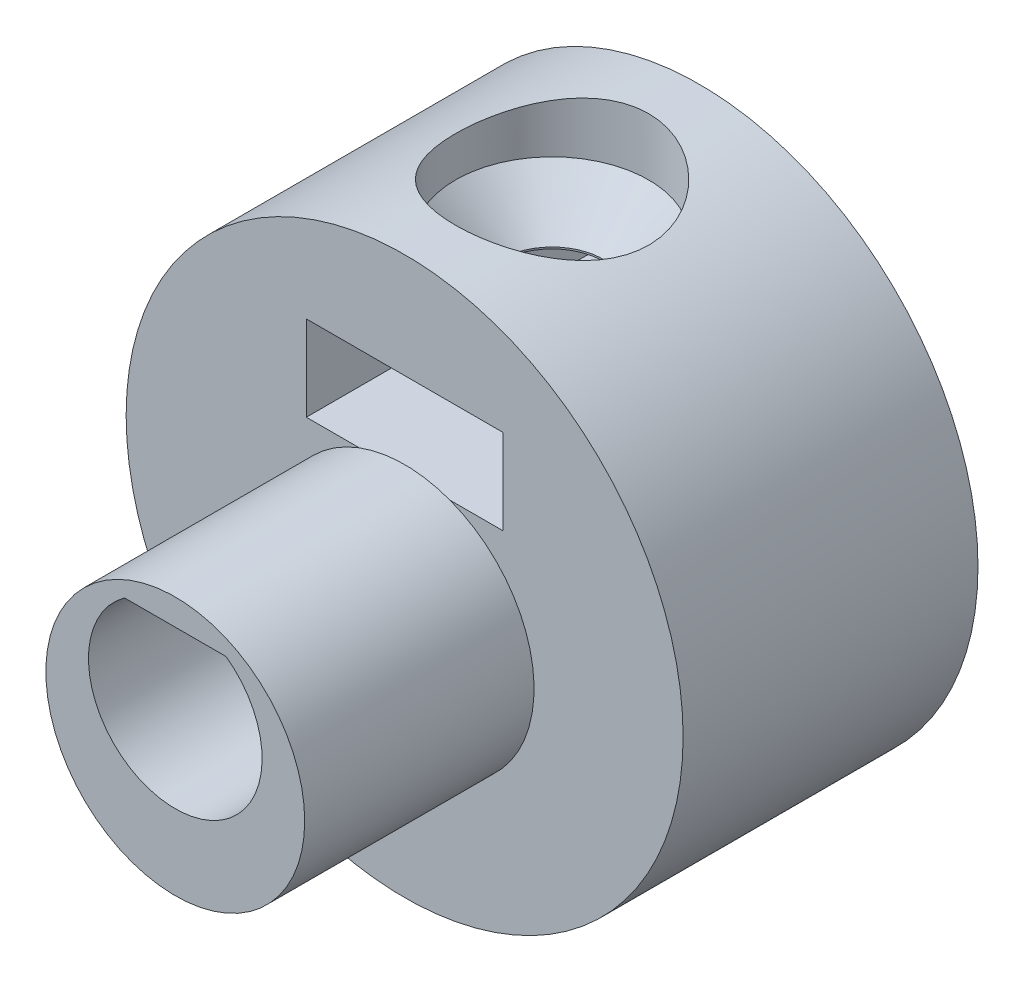
from build123d import *

# Parameters (mm, degrees)
ESQUISSE1_R             = 8.5
BOSS_EXTRU_1_DEPTH      = 9
ESQUISSE2_W             = 6
ESQUISSE2_H             = 2.6
ENL_V_MAT_EXTRU_1_DEPTH = 16.016657418
ESQUISSE7_R             = 2.95
ENL_V_MAT_EXTRU_8_DEPTH = 21.868397324
ESQUISSE9_R             = 3.95
BOSS_EXTRU_2_DEPTH      = 7
ENL_V_MAT_EXTRU_9_DEPTH = 21.012496182


with BuildPart() as part:
    # Esquisse1 → Boss.-Extru.1 (new body)
    with BuildSketch(Plane.XY):
        Circle(ESQUISSE1_R)
    extrude(amount=BOSS_EXTRU_1_DEPTH)

    # Esquisse2 → Enlèv. mat.-Extru.1 (cut, through all)
    with BuildSketch(Plane(origin=(0, 0, 0), x_dir=(-1, 0, 0), z_dir=(0, 0, -1))):
        with Locations((0, 4)):
            Rectangle(ESQUISSE2_W, ESQUISSE2_H)
    extrude(amount=-ENL_V_MAT_EXTRU_1_DEPTH, mode=Mode.SUBTRACT)

    # Enlèv. mat.-Extru.2: read off the stored shape, not the designer's step
    # Enlèv. mat.-Extru.2 outline → Enlèv. mat.-Extru.2 (revolve, cut)
    with BuildSketch(Plane.XY.offset(4.5)):
        Polygon((0, 5.3), (1.554616831, 5.3), (1.498760014, 8.500034923), (0, 8.500034923), align=None)
        Polygon((1.6, 2.7), (0, 2.7), (0, 0.7), (1.56508987, 0.7), align=None)
    revolve(axis=Axis((0, 0, 4.5), (0, 1, 0)), mode=Mode.SUBTRACT)

    # Esquisse7 → Enlèv. mat.-Extru.8 (cut, through all)
    with BuildSketch(Plane(origin=(0, 8.3, 0), x_dir=(1, 0, 0), z_dir=(0, 1, 0))):
        with Locations((0, -4.5)):
            Circle(ESQUISSE7_R)
    extrude(amount=ENL_V_MAT_EXTRU_8_DEPTH, mode=Mode.SUBTRACT)

    # Chanfrein1: read off the stored shape, not the designer's step
    # Chanfrein1 outline → Chanfrein1 (revolve, cut)
    with BuildSketch(Plane.XY.offset(4.5)):
        Polygon((2.95, 6.747748364), (2.95, 8.3), (1.502251636, 8.3), (1.553718474, 5.351466838), align=None)
    revolve(axis=Axis((0, 0, 4.5), (0, 1, 0)), mode=Mode.SUBTRACT)

    # Esquisse9 → Boss.-Extru.2 (add)
    with BuildSketch(Plane.XY.offset(9)):
        with Locations(Location((0, -1, 0), (0, 0, 110.493999506))):
            Circle(ESQUISSE9_R)
    extrude(amount=BOSS_EXTRU_2_DEPTH)

    # Esquisse10 → Enlèv. mat.-Extru.9 (cut, through all)
    with BuildSketch(Plane(origin=(0, 0, 0), x_dir=(-1, 0, 0), z_dir=(0, 0, -1))):
        with BuildLine():
            Line((-1.549193338, 2.15), (1.549193338, 2.15))
            ThreePointArc((1.549193338, 2.15), (0, -2.65), (-1.549193338, 2.15))
        make_face()
    extrude(amount=-ENL_V_MAT_EXTRU_9_DEPTH, mode=Mode.SUBTRACT)


solid = part.part
